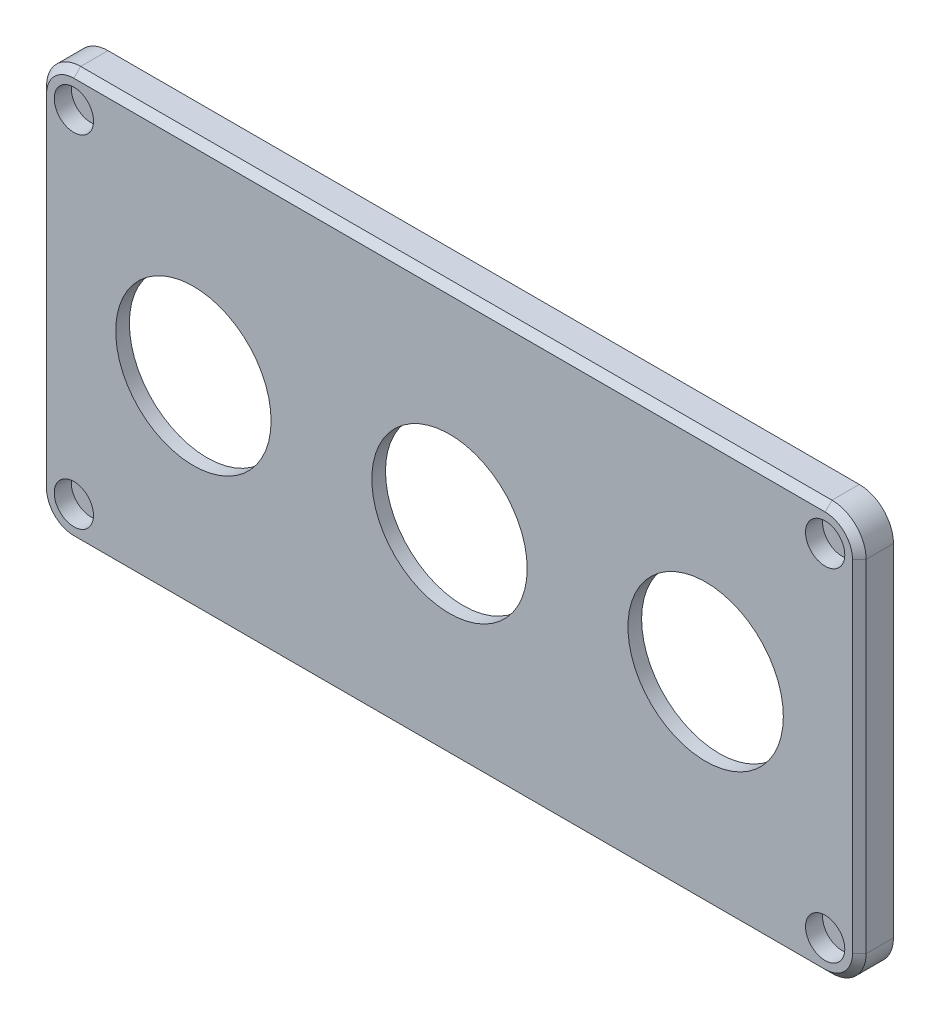
from build123d import *

# Parameters (mm, degrees)
SKETCH1_W           = 120
SKETCH1_H           = 60
BOSS_EXTRUDE1_DEPTH = 5
SKETCH2_R           = 11.375
CUT_EXTRUDE1_DEPTH  = 68.268120235
FILLET1_R           = 5
SKETCH3_R           = 1.6
CUT_EXTRUDE2_DEPTH  = 68.268120235
SKETCH4_R           = 2.875
CUT_EXTRUDE3_DEPTH  = 2.5
CHAMFER1_SIZE       = 1
SKETCH5_R           = 16
CUT_EXTRUDE4_DEPTH  = 3
SKETCH6_R           = 2.5
BOSS_EXTRUDE2_DEPTH = 0.15


with BuildPart() as part:
    # Sketch1 → Boss-Extrude1 (new body)
    with BuildSketch(Plane.XY):
        Rectangle(SKETCH1_W, SKETCH1_H)
    extrude(amount=BOSS_EXTRUDE1_DEPTH)

    # Sketch2 → Cut-Extrude1 (cut, through all)
    with BuildSketch(Plane.XY.offset(5)):
        Circle(SKETCH2_R)
        with Locations((37.5, 0)):
            Circle(SKETCH2_R)
        with Locations((-37.5, 0)):
            Circle(SKETCH2_R)
    extrude(amount=-CUT_EXTRUDE1_DEPTH, mode=Mode.SUBTRACT)

    # Fillet1
    fillet1_edges = [part.edges().sort_by_distance(p)[0] for p in [
        (-60, -30, 2.5),
        (60, -30, 2.5),
        (60, 30, 2.5),
        (-60, 30, 2.5),
    ]]
    fillet(fillet1_edges, radius=FILLET1_R)

    # Sketch3 → Cut-Extrude2 (cut, through all)
    with BuildSketch(Plane.XY.offset(5)):
        with Locations((-55, 25)):
            Circle(SKETCH3_R)
        with Locations((55, 25)):
            Circle(SKETCH3_R)
        with Locations((55, -25)):
            Circle(SKETCH3_R)
        with Locations((-55, -25)):
            Circle(SKETCH3_R)
    extrude(amount=-CUT_EXTRUDE2_DEPTH, mode=Mode.SUBTRACT)

    # Sketch4 → Cut-Extrude3 (cut)
    with BuildSketch(Plane.XY.offset(5)):
        with Locations((-55, 25)):
            Circle(SKETCH4_R)
        with Locations((55, 25)):
            Circle(SKETCH4_R)
        with Locations((55, -25)):
            Circle(SKETCH4_R)
        with Locations((-55, -25)):
            Circle(SKETCH4_R)
    extrude(amount=-CUT_EXTRUDE3_DEPTH, mode=Mode.SUBTRACT)

    # Chamfer1
    chamfer1_edges = [part.edges().sort_by_distance(p)[0] for p in [
        (0, -30, 5),
        (58.535533906, -28.535533906, 5),
        (-58.535533906, -28.535533906, 5),
        (60, 0, 5),
        (-60, 0, 5),
        (58.535533906, 28.535533906, 5),
        (-58.535533906, 28.535533906, 5),
        (0, 30, 5),
    ]]
    chamfer(chamfer1_edges, length=CHAMFER1_SIZE)

    # Sketch5 → Cut-Extrude4 (cut)
    with BuildSketch(Plane(origin=(0, 0, 0), x_dir=(-1, 0, 0), z_dir=(0, 0, -1))):
        with Locations((-37.5, 0)):
            Circle(SKETCH5_R)
        Circle(SKETCH5_R)
        with Locations((37.5, 0)):
            Circle(SKETCH5_R)
    extrude(amount=-CUT_EXTRUDE4_DEPTH, mode=Mode.SUBTRACT)

    # Sketch6 → Boss-Extrude2 (add)
    with BuildSketch(Plane.XY.offset(2.5)):
        with Locations((-55, 25)):
            Circle(SKETCH6_R)
        with Locations((55, 25)):
            Circle(SKETCH6_R)
        with Locations((55, -25)):
            Circle(SKETCH6_R)
        with Locations((-55, -25)):
            Circle(SKETCH6_R)
    extrude(amount=-BOSS_EXTRUDE2_DEPTH)


solid = part.part
